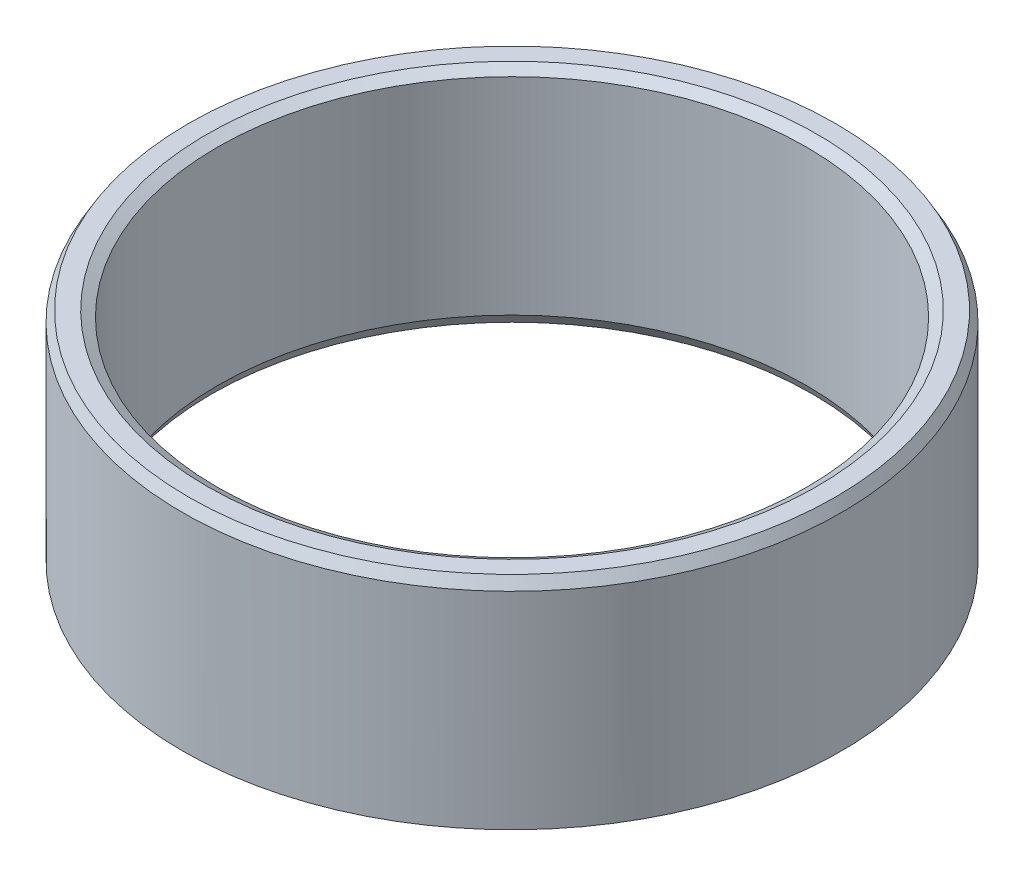
from build123d import *
from OCP.BRepFilletAPI import BRepFilletAPI_MakeChamfer

# Parameters (mm, degrees)
SKETCH1_R           = 45
BOSS_EXTRUDE1_DEPTH = 30.441056604
SKETCH2_R           = 40.227595537
CUT_EXTRUDE1_DEPTH  = 71.545431653
CHAMFER1_SIZE       = 1.423098678
CHAMFER1_SIZE2      = 0.821626405


with BuildPart() as part:
    # Sketch1 → Boss-Extrude1 (new body)
    with BuildSketch(Plane(origin=(0, 0, 0), x_dir=(1, 0, 0), z_dir=(0, 1, 0))):
        Circle(SKETCH1_R)
    extrude(amount=BOSS_EXTRUDE1_DEPTH)

    # Sketch2 → Cut-Extrude1 (cut, through all)
    with BuildSketch(Plane(origin=(0, 0, 0), x_dir=(1, 0, 0), z_dir=(0, 1, 0))):
        Circle(SKETCH2_R)
    extrude(amount=CUT_EXTRUDE1_DEPTH, mode=Mode.SUBTRACT)

    # Chamfer1: one chamfer whose edges measure the first distance from different faces: ONE call of the kernel's chamfer builder (chamfer() names one face for all edges)
    chamfer1_edges_1 = [part.edges().sort_by_distance(p)[0] for p in [
        (-40.227595537, 30.441056604, 0),
    ]]
    chamfer1_side_1 = [part.faces().sort_by_distance(p)[0] for p in [
        (-43.727207794, 30.441056604, 0),
    ]]
    chamfer1_edges_2 = [part.edges().sort_by_distance(p)[0] for p in [
        (-40.227595537, 0, 0),
    ]]
    chamfer1_side_2 = [part.faces().sort_by_distance(p)[0] for p in [
        (-40.227595537, 15.220528302, 0),
    ]]
    chamfer1_edges_3 = [part.edges().sort_by_distance(p)[0] for p in [
        (-45, 0, 0),
    ]]
    chamfer1_side_3 = [part.faces().sort_by_distance(p)[0] for p in [
        (-43.727207794, 0, 0),
    ]]
    chamfer1_edges_4 = [part.edges().sort_by_distance(p)[0] for p in [
        (-45, 30.441056604, 0),
    ]]
    chamfer1_side_4 = [part.faces().sort_by_distance(p)[0] for p in [
        (-45, 15.220528302, 0),
    ]]
    chamfer1 = BRepFilletAPI_MakeChamfer(part.part.solid().wrapped)
    for e in chamfer1_edges_1:
        chamfer1.Add(CHAMFER1_SIZE, CHAMFER1_SIZE2, e.wrapped, chamfer1_side_1[0].wrapped)  # the first distance lies on this face
    for e in chamfer1_edges_2:
        chamfer1.Add(CHAMFER1_SIZE, CHAMFER1_SIZE2, e.wrapped, chamfer1_side_2[0].wrapped)  # the first distance lies on this face
    for e in chamfer1_edges_3:
        chamfer1.Add(CHAMFER1_SIZE, CHAMFER1_SIZE2, e.wrapped, chamfer1_side_3[0].wrapped)  # the first distance lies on this face
    for e in chamfer1_edges_4:
        chamfer1.Add(CHAMFER1_SIZE, CHAMFER1_SIZE2, e.wrapped, chamfer1_side_4[0].wrapped)  # the first distance lies on this face
    add(Compound.cast(chamfer1.Shape()), mode=Mode.REPLACE)


solid = part.part
